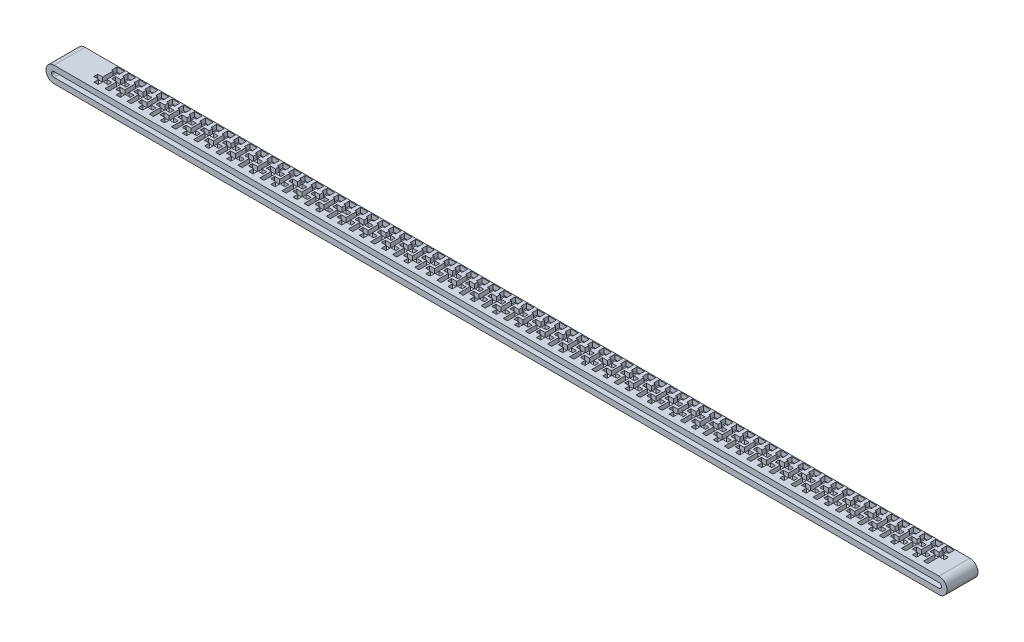
from build123d import *

# Parameters (mm, degrees)
BOSS_EXTRUDE1_DEPTH = 140
CUT_EXTRUDE1_DEPTH  = 21


with BuildPart() as part:
    # Sketch1 → Boss-Extrude1 (new body)
    with BuildSketch(Plane.XY):
        with BuildLine():
            Line((-3934.06198402, 39.535153864), (65.93801598, 39.535153864))
            ThreePointArc((65.93801598, 39.535153864), (102.323258292, 3.149911553), (65.93801598, -33.235330759))
            Line((65.93801598, -33.235330759), (-3934.06198402, -33.235330759))
            ThreePointArc((-3934.06198402, -33.235330759), (-3970.447226332, 3.149911553), (-3934.06198402, 39.535153864))
        make_face()
        with BuildLine():
            Line((-3934.06198402, 14.535153864), (65.93801598, 14.535153864))
            ThreePointArc((65.93801598, 14.535153864), (77.323258292, 3.149911553), (65.93801598, -8.235330759))
            Line((65.93801598, -8.235330759), (-3934.06198402, -8.235330759))
            ThreePointArc((-3934.06198402, -8.235330759), (-3945.447226332, 3.149911553), (-3934.06198402, 14.535153864))
        make_face(mode=Mode.SUBTRACT)
    extrude(amount=BOSS_EXTRUDE1_DEPTH)

    # Sketch2 → Cut-Extrude1 (cut)
    with BuildSketch(Plane(origin=(0, 39.535153864, 0), x_dir=(1, 0, 0), z_dir=(0, 1, 0))):
        Polygon((-3777.60668084, -116.120959158), (-3758.60668084, -116.120959158), (-3758.60668084, -93.616423016), (-3736.10668084, -93.616423016), (-3736.10668084, -76.5), (-3758.60668084, -76.5), (-3758.60668084, -29.120959158), (-3751.10668084, -29.120959158), (-3751.10668084, -4.120959158), (-3785.10668084, -4.120959158), (-3785.10668084, -29.120959158), (-3777.60668084, -29.120959158), (-3777.60668084, -76.5), (-3800.10668084, -76.5), (-3800.10668084, -94.5), (-3777.60668084, -94.5), align=None)
        Polygon((-3727.606672513, -116.120959158), (-3708.606672513, -116.120959158), (-3708.606672513, -63.5), (-3686.106672513, -63.5), (-3686.106672513, -45.5), (-3708.606672513, -45.5), (-3708.60668084, -29.120959158), (-3701.10668084, -29.120959158), (-3701.10668084, -4.120959158), (-3735.10668084, -4.120959158), (-3735.10668084, -29.120959158), (-3727.60668084, -29.120959158), (-3727.606672513, -45.5), (-3750.106672513, -45.5), (-3750.106672513, -63.5), (-3727.606672513, -63.5), align=None)
        Polygon((-3677.60668084, -94.5), (-3677.60668084, -116.120959158), (-3658.60668084, -116.120959158), (-3658.60668084, -93.616423016), (-3636.10668084, -93.616423016), (-3636.10668084, -76.5), (-3658.60668084, -76.5), (-3658.60668084, -29.120959158), (-3651.10668084, -29.120959158), (-3651.10668084, -4.120959158), (-3685.10668084, -4.120959158), (-3685.10668084, -29.120959158), (-3677.60668084, -29.120959158), (-3677.60668084, -76.5), (-3700.10668084, -76.5), (-3700.10668084, -94.5), align=None)
        Polygon((-3577.60668084, -94.5), (-3577.60668084, -116.120959158), (-3558.60668084, -116.120959158), (-3558.60668084, -93.616423016), (-3536.10668084, -93.616423016), (-3536.10668084, -76.5), (-3558.60668084, -76.5), (-3558.60668084, -29.120959158), (-3551.10668084, -29.120959158), (-3551.10668084, -4.120959158), (-3585.10668084, -4.120959158), (-3585.10668084, -29.120959158), (-3577.60668084, -29.120959158), (-3577.60668084, -76.5), (-3600.10668084, -76.5), (-3600.10668084, -94.5), align=None)
        Polygon((-3477.60668084, -94.5), (-3477.60668084, -116.120959158), (-3458.60668084, -116.120959158), (-3458.60668084, -93.616423016), (-3436.10668084, -93.616423016), (-3436.10668084, -76.5), (-3458.60668084, -76.5), (-3458.60668084, -29.120959158), (-3451.10668084, -29.120959158), (-3451.10668084, -4.120959158), (-3485.10668084, -4.120959158), (-3485.10668084, -29.120959158), (-3477.60668084, -29.120959158), (-3477.60668084, -76.5), (-3500.10668084, -76.5), (-3500.10668084, -94.5), align=None)
        Polygon((-3377.60668084, -94.5), (-3377.60668084, -116.120959158), (-3358.60668084, -116.120959158), (-3358.60668084, -93.616423016), (-3336.10668084, -93.616423016), (-3336.10668084, -76.5), (-3358.60668084, -76.5), (-3358.60668084, -29.120959158), (-3351.10668084, -29.120959158), (-3351.10668084, -4.120959158), (-3385.10668084, -4.120959158), (-3385.10668084, -29.120959158), (-3377.60668084, -29.120959158), (-3377.60668084, -76.5), (-3400.10668084, -76.5), (-3400.10668084, -94.5), align=None)
        Polygon((-3277.60668084, -94.5), (-3277.60668084, -116.120959158), (-3258.60668084, -116.120959158), (-3258.60668084, -93.616423016), (-3236.10668084, -93.616423016), (-3236.10668084, -76.5), (-3258.60668084, -76.5), (-3258.60668084, -29.120959158), (-3251.10668084, -29.120959158), (-3251.10668084, -4.120959158), (-3285.10668084, -4.120959158), (-3285.10668084, -29.120959158), (-3277.60668084, -29.120959158), (-3277.60668084, -76.5), (-3300.10668084, -76.5), (-3300.10668084, -94.5), align=None)
        Polygon((-3177.60668084, -94.5), (-3177.60668084, -116.120959158), (-3158.60668084, -116.120959158), (-3158.60668084, -93.616423016), (-3136.10668084, -93.616423016), (-3136.10668084, -76.5), (-3158.60668084, -76.5), (-3158.60668084, -29.120959158), (-3151.10668084, -29.120959158), (-3151.10668084, -4.120959158), (-3185.10668084, -4.120959158), (-3185.10668084, -29.120959158), (-3177.60668084, -29.120959158), (-3177.60668084, -76.5), (-3200.10668084, -76.5), (-3200.10668084, -94.5), align=None)
        Polygon((-3077.60668084, -94.5), (-3077.60668084, -116.120959158), (-3058.60668084, -116.120959158), (-3058.60668084, -93.616423016), (-3036.10668084, -93.616423016), (-3036.10668084, -76.5), (-3058.60668084, -76.5), (-3058.60668084, -29.120959158), (-3051.10668084, -29.120959158), (-3051.10668084, -4.120959158), (-3085.10668084, -4.120959158), (-3085.10668084, -29.120959158), (-3077.60668084, -29.120959158), (-3077.60668084, -76.5), (-3100.10668084, -76.5), (-3100.10668084, -94.5), align=None)
        Polygon((-2977.60668084, -94.5), (-2977.60668084, -116.120959158), (-2958.60668084, -116.120959158), (-2958.60668084, -93.616423016), (-2936.10668084, -93.616423016), (-2936.10668084, -76.5), (-2958.60668084, -76.5), (-2958.60668084, -29.120959158), (-2951.10668084, -29.120959158), (-2951.10668084, -4.120959158), (-2985.10668084, -4.120959158), (-2985.10668084, -29.120959158), (-2977.60668084, -29.120959158), (-2977.60668084, -76.5), (-3000.10668084, -76.5), (-3000.10668084, -94.5), align=None)
        Polygon((-2877.60668084, -94.5), (-2877.60668084, -116.120959158), (-2858.60668084, -116.120959158), (-2858.60668084, -93.616423016), (-2836.10668084, -93.616423016), (-2836.10668084, -76.5), (-2858.60668084, -76.5), (-2858.60668084, -29.120959158), (-2851.10668084, -29.120959158), (-2851.10668084, -4.120959158), (-2885.10668084, -4.120959158), (-2885.10668084, -29.120959158), (-2877.60668084, -29.120959158), (-2877.60668084, -76.5), (-2900.10668084, -76.5), (-2900.10668084, -94.5), align=None)
        Polygon((-2777.60668084, -94.5), (-2777.60668084, -116.120959158), (-2758.60668084, -116.120959158), (-2758.60668084, -93.616423016), (-2736.10668084, -93.616423016), (-2736.10668084, -76.5), (-2758.60668084, -76.5), (-2758.60668084, -29.120959158), (-2751.10668084, -29.120959158), (-2751.10668084, -4.120959158), (-2785.10668084, -4.120959158), (-2785.10668084, -29.120959158), (-2777.60668084, -29.120959158), (-2777.60668084, -76.5), (-2800.10668084, -76.5), (-2800.10668084, -94.5), align=None)
        Polygon((-2677.60668084, -94.5), (-2677.60668084, -116.120959158), (-2658.60668084, -116.120959158), (-2658.60668084, -93.616423016), (-2636.10668084, -93.616423016), (-2636.10668084, -76.5), (-2658.60668084, -76.5), (-2658.60668084, -29.120959158), (-2651.10668084, -29.120959158), (-2651.10668084, -4.120959158), (-2685.10668084, -4.120959158), (-2685.10668084, -29.120959158), (-2677.60668084, -29.120959158), (-2677.60668084, -76.5), (-2700.10668084, -76.5), (-2700.10668084, -94.5), align=None)
        Polygon((-2577.60668084, -94.5), (-2577.60668084, -116.120959158), (-2558.60668084, -116.120959158), (-2558.60668084, -93.616423016), (-2536.10668084, -93.616423016), (-2536.10668084, -76.5), (-2558.60668084, -76.5), (-2558.60668084, -29.120959158), (-2551.10668084, -29.120959158), (-2551.10668084, -4.120959158), (-2585.10668084, -4.120959158), (-2585.10668084, -29.120959158), (-2577.60668084, -29.120959158), (-2577.60668084, -76.5), (-2600.10668084, -76.5), (-2600.10668084, -94.5), align=None)
        Polygon((-2477.60668084, -94.5), (-2477.60668084, -116.120959158), (-2458.60668084, -116.120959158), (-2458.60668084, -93.616423016), (-2436.10668084, -93.616423016), (-2436.10668084, -76.5), (-2458.60668084, -76.5), (-2458.60668084, -29.120959158), (-2451.10668084, -29.120959158), (-2451.10668084, -4.120959158), (-2485.10668084, -4.120959158), (-2485.10668084, -29.120959158), (-2477.60668084, -29.120959158), (-2477.60668084, -76.5), (-2500.10668084, -76.5), (-2500.10668084, -94.5), align=None)
        Polygon((-2377.60668084, -94.5), (-2377.60668084, -116.120959158), (-2358.60668084, -116.120959158), (-2358.60668084, -93.616423016), (-2336.10668084, -93.616423016), (-2336.10668084, -76.5), (-2358.60668084, -76.5), (-2358.60668084, -29.120959158), (-2351.10668084, -29.120959158), (-2351.10668084, -4.120959158), (-2385.10668084, -4.120959158), (-2385.10668084, -29.120959158), (-2377.60668084, -29.120959158), (-2377.60668084, -76.5), (-2400.10668084, -76.5), (-2400.10668084, -94.5), align=None)
        Polygon((-2277.60668084, -94.5), (-2277.60668084, -116.120959158), (-2258.60668084, -116.120959158), (-2258.60668084, -93.616423016), (-2236.10668084, -93.616423016), (-2236.10668084, -76.5), (-2258.60668084, -76.5), (-2258.60668084, -29.120959158), (-2251.10668084, -29.120959158), (-2251.10668084, -4.120959158), (-2285.10668084, -4.120959158), (-2285.10668084, -29.120959158), (-2277.60668084, -29.120959158), (-2277.60668084, -76.5), (-2300.10668084, -76.5), (-2300.10668084, -94.5), align=None)
        Polygon((-2177.60668084, -94.5), (-2177.60668084, -116.120959158), (-2158.60668084, -116.120959158), (-2158.60668084, -93.616423016), (-2136.10668084, -93.616423016), (-2136.10668084, -76.5), (-2158.60668084, -76.5), (-2158.60668084, -29.120959158), (-2151.10668084, -29.120959158), (-2151.10668084, -4.120959158), (-2185.10668084, -4.120959158), (-2185.10668084, -29.120959158), (-2177.60668084, -29.120959158), (-2177.60668084, -76.5), (-2200.10668084, -76.5), (-2200.10668084, -94.5), align=None)
        Polygon((-2077.60668084, -94.5), (-2077.60668084, -116.120959158), (-2058.60668084, -116.120959158), (-2058.60668084, -93.616423016), (-2036.10668084, -93.616423016), (-2036.10668084, -76.5), (-2058.60668084, -76.5), (-2058.60668084, -29.120959158), (-2051.10668084, -29.120959158), (-2051.10668084, -4.120959158), (-2085.10668084, -4.120959158), (-2085.10668084, -29.120959158), (-2077.60668084, -29.120959158), (-2077.60668084, -76.5), (-2100.10668084, -76.5), (-2100.10668084, -94.5), align=None)
        Polygon((-1977.60668084, -94.5), (-1977.60668084, -116.120959158), (-1958.60668084, -116.120959158), (-1958.60668084, -93.616423016), (-1936.10668084, -93.616423016), (-1936.10668084, -76.5), (-1958.60668084, -76.5), (-1958.60668084, -29.120959158), (-1951.10668084, -29.120959158), (-1951.10668084, -4.120959158), (-1985.10668084, -4.120959158), (-1985.10668084, -29.120959158), (-1977.60668084, -29.120959158), (-1977.60668084, -76.5), (-2000.10668084, -76.5), (-2000.10668084, -94.5), align=None)
        Polygon((-1877.60668084, -94.5), (-1877.60668084, -116.120959158), (-1858.60668084, -116.120959158), (-1858.60668084, -93.616423016), (-1836.10668084, -93.616423016), (-1836.10668084, -76.5), (-1858.60668084, -76.5), (-1858.60668084, -29.120959158), (-1851.10668084, -29.120959158), (-1851.10668084, -4.120959158), (-1885.10668084, -4.120959158), (-1885.10668084, -29.120959158), (-1877.60668084, -29.120959158), (-1877.60668084, -76.5), (-1900.10668084, -76.5), (-1900.10668084, -94.5), align=None)
        Polygon((-1777.60668084, -94.5), (-1777.60668084, -116.120959158), (-1758.60668084, -116.120959158), (-1758.60668084, -93.616423016), (-1736.10668084, -93.616423016), (-1736.10668084, -76.5), (-1758.60668084, -76.5), (-1758.60668084, -29.120959158), (-1751.10668084, -29.120959158), (-1751.10668084, -4.120959158), (-1785.10668084, -4.120959158), (-1785.10668084, -29.120959158), (-1777.60668084, -29.120959158), (-1777.60668084, -76.5), (-1800.10668084, -76.5), (-1800.10668084, -94.5), align=None)
        Polygon((-1677.60668084, -94.5), (-1677.60668084, -116.120959158), (-1658.60668084, -116.120959158), (-1658.60668084, -93.616423016), (-1636.10668084, -93.616423016), (-1636.10668084, -76.5), (-1658.60668084, -76.5), (-1658.60668084, -29.120959158), (-1651.10668084, -29.120959158), (-1651.10668084, -4.120959158), (-1685.10668084, -4.120959158), (-1685.10668084, -29.120959158), (-1677.60668084, -29.120959158), (-1677.60668084, -76.5), (-1700.10668084, -76.5), (-1700.10668084, -94.5), align=None)
        Polygon((-1577.60668084, -94.5), (-1577.60668084, -116.120959158), (-1558.60668084, -116.120959158), (-1558.60668084, -93.616423016), (-1536.10668084, -93.616423016), (-1536.10668084, -76.5), (-1558.60668084, -76.5), (-1558.60668084, -29.120959158), (-1551.10668084, -29.120959158), (-1551.10668084, -4.120959158), (-1585.10668084, -4.120959158), (-1585.10668084, -29.120959158), (-1577.60668084, -29.120959158), (-1577.60668084, -76.5), (-1600.10668084, -76.5), (-1600.10668084, -94.5), align=None)
        Polygon((-1477.60668084, -94.5), (-1477.60668084, -116.120959158), (-1458.60668084, -116.120959158), (-1458.60668084, -93.616423016), (-1436.10668084, -93.616423016), (-1436.10668084, -76.5), (-1458.60668084, -76.5), (-1458.60668084, -29.120959158), (-1451.10668084, -29.120959158), (-1451.10668084, -4.120959158), (-1485.10668084, -4.120959158), (-1485.10668084, -29.120959158), (-1477.60668084, -29.120959158), (-1477.60668084, -76.5), (-1500.10668084, -76.5), (-1500.10668084, -94.5), align=None)
        Polygon((-1377.60668084, -94.5), (-1377.60668084, -116.120959158), (-1358.60668084, -116.120959158), (-1358.60668084, -93.616423016), (-1336.10668084, -93.616423016), (-1336.10668084, -76.5), (-1358.60668084, -76.5), (-1358.60668084, -29.120959158), (-1351.10668084, -29.120959158), (-1351.10668084, -4.120959158), (-1385.10668084, -4.120959158), (-1385.10668084, -29.120959158), (-1377.60668084, -29.120959158), (-1377.60668084, -76.5), (-1400.10668084, -76.5), (-1400.10668084, -94.5), align=None)
        Polygon((-1277.60668084, -94.5), (-1277.60668084, -116.120959158), (-1258.60668084, -116.120959158), (-1258.60668084, -93.616423016), (-1236.10668084, -93.616423016), (-1236.10668084, -76.5), (-1258.60668084, -76.5), (-1258.60668084, -29.120959158), (-1251.10668084, -29.120959158), (-1251.10668084, -4.120959158), (-1285.10668084, -4.120959158), (-1285.10668084, -29.120959158), (-1277.60668084, -29.120959158), (-1277.60668084, -76.5), (-1300.10668084, -76.5), (-1300.10668084, -94.5), align=None)
        Polygon((-1177.60668084, -94.5), (-1177.60668084, -116.120959158), (-1158.60668084, -116.120959158), (-1158.60668084, -93.616423016), (-1136.10668084, -93.616423016), (-1136.10668084, -76.5), (-1158.60668084, -76.5), (-1158.60668084, -29.120959158), (-1151.10668084, -29.120959158), (-1151.10668084, -4.120959158), (-1185.10668084, -4.120959158), (-1185.10668084, -29.120959158), (-1177.60668084, -29.120959158), (-1177.60668084, -76.5), (-1200.10668084, -76.5), (-1200.10668084, -94.5), align=None)
        Polygon((-1077.60668084, -94.5), (-1077.60668084, -116.120959158), (-1058.60668084, -116.120959158), (-1058.60668084, -93.616423016), (-1036.10668084, -93.616423016), (-1036.10668084, -76.5), (-1058.60668084, -76.5), (-1058.60668084, -29.120959158), (-1051.10668084, -29.120959158), (-1051.10668084, -4.120959158), (-1085.10668084, -4.120959158), (-1085.10668084, -29.120959158), (-1077.60668084, -29.120959158), (-1077.60668084, -76.5), (-1100.10668084, -76.5), (-1100.10668084, -94.5), align=None)
        Polygon((-977.60668084, -94.5), (-977.60668084, -116.120959158), (-958.60668084, -116.120959158), (-958.60668084, -93.616423016), (-936.10668084, -93.616423016), (-936.10668084, -76.5), (-958.60668084, -76.5), (-958.60668084, -29.120959158), (-951.10668084, -29.120959158), (-951.10668084, -4.120959158), (-985.10668084, -4.120959158), (-985.10668084, -29.120959158), (-977.60668084, -29.120959158), (-977.60668084, -76.5), (-1000.10668084, -76.5), (-1000.10668084, -94.5), align=None)
        Polygon((-877.60668084, -94.5), (-877.60668084, -116.120959158), (-858.60668084, -116.120959158), (-858.60668084, -93.616423016), (-836.10668084, -93.616423016), (-836.10668084, -76.5), (-858.60668084, -76.5), (-858.60668084, -29.120959158), (-851.10668084, -29.120959158), (-851.10668084, -4.120959158), (-885.10668084, -4.120959158), (-885.10668084, -29.120959158), (-877.60668084, -29.120959158), (-877.60668084, -76.5), (-900.10668084, -76.5), (-900.10668084, -94.5), align=None)
        Polygon((-777.60668084, -94.5), (-777.60668084, -116.120959158), (-758.60668084, -116.120959158), (-758.60668084, -93.616423016), (-736.10668084, -93.616423016), (-736.10668084, -76.5), (-758.60668084, -76.5), (-758.60668084, -29.120959158), (-751.10668084, -29.120959158), (-751.10668084, -4.120959158), (-785.10668084, -4.120959158), (-785.10668084, -29.120959158), (-777.60668084, -29.120959158), (-777.60668084, -76.5), (-800.10668084, -76.5), (-800.10668084, -94.5), align=None)
        Polygon((-677.60668084, -94.5), (-677.60668084, -116.120959158), (-658.60668084, -116.120959158), (-658.60668084, -93.616423016), (-636.10668084, -93.616423016), (-636.10668084, -76.5), (-658.60668084, -76.5), (-658.60668084, -29.120959158), (-651.10668084, -29.120959158), (-651.10668084, -4.120959158), (-685.10668084, -4.120959158), (-685.10668084, -29.120959158), (-677.60668084, -29.120959158), (-677.60668084, -76.5), (-700.10668084, -76.5), (-700.10668084, -94.5), align=None)
        Polygon((-577.60668084, -94.5), (-577.60668084, -116.120959158), (-558.60668084, -116.120959158), (-558.60668084, -93.616423016), (-536.10668084, -93.616423016), (-536.10668084, -76.5), (-558.60668084, -76.5), (-558.60668084, -29.120959158), (-551.10668084, -29.120959158), (-551.10668084, -4.120959158), (-585.10668084, -4.120959158), (-585.10668084, -29.120959158), (-577.60668084, -29.120959158), (-577.60668084, -76.5), (-600.10668084, -76.5), (-600.10668084, -94.5), align=None)
        Polygon((-477.60668084, -94.5), (-477.60668084, -116.120959158), (-458.60668084, -116.120959158), (-458.60668084, -93.616423016), (-436.10668084, -93.616423016), (-436.10668084, -76.5), (-458.60668084, -76.5), (-458.60668084, -29.120959158), (-451.10668084, -29.120959158), (-451.10668084, -4.120959158), (-485.10668084, -4.120959158), (-485.10668084, -29.120959158), (-477.60668084, -29.120959158), (-477.60668084, -76.5), (-500.10668084, -76.5), (-500.10668084, -94.5), align=None)
        Polygon((-377.60668084, -94.5), (-377.60668084, -116.120959158), (-358.60668084, -116.120959158), (-358.60668084, -93.616423016), (-336.10668084, -93.616423016), (-336.10668084, -76.5), (-358.60668084, -76.5), (-358.60668084, -29.120959158), (-351.10668084, -29.120959158), (-351.10668084, -4.120959158), (-385.10668084, -4.120959158), (-385.10668084, -29.120959158), (-377.60668084, -29.120959158), (-377.60668084, -76.5), (-400.10668084, -76.5), (-400.10668084, -94.5), align=None)
        Polygon((-277.60668084, -94.5), (-277.60668084, -116.120959158), (-258.60668084, -116.120959158), (-258.60668084, -93.616423016), (-236.10668084, -93.616423016), (-236.10668084, -76.5), (-258.60668084, -76.5), (-258.60668084, -29.120959158), (-251.10668084, -29.120959158), (-251.10668084, -4.120959158), (-285.10668084, -4.120959158), (-285.10668084, -29.120959158), (-277.60668084, -29.120959158), (-277.60668084, -76.5), (-300.10668084, -76.5), (-300.10668084, -94.5), align=None)
        Polygon((-177.60668084, -94.5), (-177.60668084, -116.120959158), (-158.60668084, -116.120959158), (-158.60668084, -93.616423016), (-136.10668084, -93.616423016), (-136.10668084, -76.5), (-158.60668084, -76.5), (-158.60668084, -29.120959158), (-151.10668084, -29.120959158), (-151.10668084, -4.120959158), (-185.10668084, -4.120959158), (-185.10668084, -29.120959158), (-177.60668084, -29.120959158), (-177.60668084, -76.5), (-200.10668084, -76.5), (-200.10668084, -94.5), align=None)
        Polygon((-77.60668084, -94.5), (-77.60668084, -116.120959158), (-58.60668084, -116.120959158), (-58.60668084, -93.616423016), (-36.10668084, -93.616423016), (-36.10668084, -76.5), (-58.60668084, -76.5), (-58.60668084, -29.120959158), (-51.10668084, -29.120959158), (-51.10668084, -4.120959158), (-85.10668084, -4.120959158), (-85.10668084, -29.120959158), (-77.60668084, -29.120959158), (-77.60668084, -76.5), (-100.10668084, -76.5), (-100.10668084, -94.5), align=None)
        Polygon((-3627.606672513, -63.5), (-3627.606672513, -116.120959158), (-3608.606672513, -116.120959158), (-3608.606672513, -63.5), (-3586.106672513, -63.5), (-3586.106672513, -45.5), (-3608.606672513, -45.5), (-3608.60668084, -29.120959158), (-3601.10668084, -29.120959158), (-3601.10668084, -4.120959158), (-3635.10668084, -4.120959158), (-3635.10668084, -29.120959158), (-3627.60668084, -29.120959158), (-3627.606672513, -45.5), (-3650.106672513, -45.5), (-3650.106672513, -63.5), align=None)
        Polygon((-3527.606672513, -63.5), (-3527.606672513, -116.120959158), (-3508.606672513, -116.120959158), (-3508.606672513, -63.5), (-3486.106672513, -63.5), (-3486.106672513, -45.5), (-3508.606672513, -45.5), (-3508.60668084, -29.120959158), (-3501.10668084, -29.120959158), (-3501.10668084, -4.120959158), (-3535.10668084, -4.120959158), (-3535.10668084, -29.120959158), (-3527.60668084, -29.120959158), (-3527.606672513, -45.5), (-3550.106672513, -45.5), (-3550.106672513, -63.5), align=None)
        Polygon((-3427.606672513, -63.5), (-3427.606672513, -116.120959158), (-3408.606672513, -116.120959158), (-3408.606672513, -63.5), (-3386.106672513, -63.5), (-3386.106672513, -45.5), (-3408.606672513, -45.5), (-3408.60668084, -29.120959158), (-3401.10668084, -29.120959158), (-3401.10668084, -4.120959158), (-3435.10668084, -4.120959158), (-3435.10668084, -29.120959158), (-3427.60668084, -29.120959158), (-3427.606672513, -45.5), (-3450.106672513, -45.5), (-3450.106672513, -63.5), align=None)
        Polygon((-3327.606672513, -63.5), (-3327.606672513, -116.120959158), (-3308.606672513, -116.120959158), (-3308.606672513, -63.5), (-3286.106672513, -63.5), (-3286.106672513, -45.5), (-3308.606672513, -45.5), (-3308.60668084, -29.120959158), (-3301.10668084, -29.120959158), (-3301.10668084, -4.120959158), (-3335.10668084, -4.120959158), (-3335.10668084, -29.120959158), (-3327.60668084, -29.120959158), (-3327.606672513, -45.5), (-3350.106672513, -45.5), (-3350.106672513, -63.5), align=None)
        Polygon((-3227.606672513, -63.5), (-3227.606672513, -116.120959158), (-3208.606672513, -116.120959158), (-3208.606672513, -63.5), (-3186.106672513, -63.5), (-3186.106672513, -45.5), (-3208.606672513, -45.5), (-3208.60668084, -29.120959158), (-3201.10668084, -29.120959158), (-3201.10668084, -4.120959158), (-3235.10668084, -4.120959158), (-3235.10668084, -29.120959158), (-3227.60668084, -29.120959158), (-3227.606672513, -45.5), (-3250.106672513, -45.5), (-3250.106672513, -63.5), align=None)
        Polygon((-3127.606672513, -63.5), (-3127.606672513, -116.120959158), (-3108.606672513, -116.120959158), (-3108.606672513, -63.5), (-3086.106672513, -63.5), (-3086.106672513, -45.5), (-3108.606672513, -45.5), (-3108.60668084, -29.120959158), (-3101.10668084, -29.120959158), (-3101.10668084, -4.120959158), (-3135.10668084, -4.120959158), (-3135.10668084, -29.120959158), (-3127.60668084, -29.120959158), (-3127.606672513, -45.5), (-3150.106672513, -45.5), (-3150.106672513, -63.5), align=None)
        Polygon((-3027.606672513, -63.5), (-3027.606672513, -116.120959158), (-3008.606672513, -116.120959158), (-3008.606672513, -63.5), (-2986.106672513, -63.5), (-2986.106672513, -45.5), (-3008.606672513, -45.5), (-3008.60668084, -29.120959158), (-3001.10668084, -29.120959158), (-3001.10668084, -4.120959158), (-3035.10668084, -4.120959158), (-3035.10668084, -29.120959158), (-3027.60668084, -29.120959158), (-3027.606672513, -45.5), (-3050.106672513, -45.5), (-3050.106672513, -63.5), align=None)
        Polygon((-2927.606672513, -63.5), (-2927.606672513, -116.120959158), (-2908.606672513, -116.120959158), (-2908.606672513, -63.5), (-2886.106672513, -63.5), (-2886.106672513, -45.5), (-2908.606672513, -45.5), (-2908.60668084, -29.120959158), (-2901.10668084, -29.120959158), (-2901.10668084, -4.120959158), (-2935.10668084, -4.120959158), (-2935.10668084, -29.120959158), (-2927.60668084, -29.120959158), (-2927.606672513, -45.5), (-2950.106672513, -45.5), (-2950.106672513, -63.5), align=None)
        Polygon((-2827.606672513, -63.5), (-2827.606672513, -116.120959158), (-2808.606672513, -116.120959158), (-2808.606672513, -63.5), (-2786.106672513, -63.5), (-2786.106672513, -45.5), (-2808.606672513, -45.5), (-2808.60668084, -29.120959158), (-2801.10668084, -29.120959158), (-2801.10668084, -4.120959158), (-2835.10668084, -4.120959158), (-2835.10668084, -29.120959158), (-2827.60668084, -29.120959158), (-2827.606672513, -45.5), (-2850.106672513, -45.5), (-2850.106672513, -63.5), align=None)
        Polygon((-2727.606672513, -63.5), (-2727.606672513, -116.120959158), (-2708.606672513, -116.120959158), (-2708.606672513, -63.5), (-2686.106672513, -63.5), (-2686.106672513, -45.5), (-2708.606672513, -45.5), (-2708.60668084, -29.120959158), (-2701.10668084, -29.120959158), (-2701.10668084, -4.120959158), (-2735.10668084, -4.120959158), (-2735.10668084, -29.120959158), (-2727.60668084, -29.120959158), (-2727.606672513, -45.5), (-2750.106672513, -45.5), (-2750.106672513, -63.5), align=None)
        Polygon((-2627.606672513, -63.5), (-2627.606672513, -116.120959158), (-2608.606672513, -116.120959158), (-2608.606672513, -63.5), (-2586.106672513, -63.5), (-2586.106672513, -45.5), (-2608.606672513, -45.5), (-2608.60668084, -29.120959158), (-2601.10668084, -29.120959158), (-2601.10668084, -4.120959158), (-2635.10668084, -4.120959158), (-2635.10668084, -29.120959158), (-2627.60668084, -29.120959158), (-2627.606672513, -45.5), (-2650.106672513, -45.5), (-2650.106672513, -63.5), align=None)
        Polygon((-2527.606672513, -63.5), (-2527.606672513, -116.120959158), (-2508.606672513, -116.120959158), (-2508.606672513, -63.5), (-2486.106672513, -63.5), (-2486.106672513, -45.5), (-2508.606672513, -45.5), (-2508.60668084, -29.120959158), (-2501.10668084, -29.120959158), (-2501.10668084, -4.120959158), (-2535.10668084, -4.120959158), (-2535.10668084, -29.120959158), (-2527.60668084, -29.120959158), (-2527.606672513, -45.5), (-2550.106672513, -45.5), (-2550.106672513, -63.5), align=None)
        Polygon((-2427.606672513, -63.5), (-2427.606672513, -116.120959158), (-2408.606672513, -116.120959158), (-2408.606672513, -63.5), (-2386.106672513, -63.5), (-2386.106672513, -45.5), (-2408.606672513, -45.5), (-2408.60668084, -29.120959158), (-2401.10668084, -29.120959158), (-2401.10668084, -4.120959158), (-2435.10668084, -4.120959158), (-2435.10668084, -29.120959158), (-2427.60668084, -29.120959158), (-2427.606672513, -45.5), (-2450.106672513, -45.5), (-2450.106672513, -63.5), align=None)
        Polygon((-2327.606672513, -63.5), (-2327.606672513, -116.120959158), (-2308.606672513, -116.120959158), (-2308.606672513, -63.5), (-2286.106672513, -63.5), (-2286.106672513, -45.5), (-2308.606672513, -45.5), (-2308.60668084, -29.120959158), (-2301.10668084, -29.120959158), (-2301.10668084, -4.120959158), (-2335.10668084, -4.120959158), (-2335.10668084, -29.120959158), (-2327.60668084, -29.120959158), (-2327.606672513, -45.5), (-2350.106672513, -45.5), (-2350.106672513, -63.5), align=None)
        Polygon((-2227.606672513, -63.5), (-2227.606672513, -116.120959158), (-2208.606672513, -116.120959158), (-2208.606672513, -63.5), (-2186.106672513, -63.5), (-2186.106672513, -45.5), (-2208.606672513, -45.5), (-2208.60668084, -29.120959158), (-2201.10668084, -29.120959158), (-2201.10668084, -4.120959158), (-2235.10668084, -4.120959158), (-2235.10668084, -29.120959158), (-2227.60668084, -29.120959158), (-2227.606672513, -45.5), (-2250.106672513, -45.5), (-2250.106672513, -63.5), align=None)
        Polygon((-2127.606672513, -63.5), (-2127.606672513, -116.120959158), (-2108.606672513, -116.120959158), (-2108.606672513, -63.5), (-2086.106672513, -63.5), (-2086.106672513, -45.5), (-2108.606672513, -45.5), (-2108.60668084, -29.120959158), (-2101.10668084, -29.120959158), (-2101.10668084, -4.120959158), (-2135.10668084, -4.120959158), (-2135.10668084, -29.120959158), (-2127.60668084, -29.120959158), (-2127.606672513, -45.5), (-2150.106672513, -45.5), (-2150.106672513, -63.5), align=None)
        Polygon((-2027.606672513, -63.5), (-2027.606672513, -116.120959158), (-2008.606672513, -116.120959158), (-2008.606672513, -63.5), (-1986.106672513, -63.5), (-1986.106672513, -45.5), (-2008.606672513, -45.5), (-2008.60668084, -29.120959158), (-2001.10668084, -29.120959158), (-2001.10668084, -4.120959158), (-2035.10668084, -4.120959158), (-2035.10668084, -29.120959158), (-2027.60668084, -29.120959158), (-2027.606672513, -45.5), (-2050.106672513, -45.5), (-2050.106672513, -63.5), align=None)
        Polygon((-1927.606672513, -63.5), (-1927.606672513, -116.120959158), (-1908.606672513, -116.120959158), (-1908.606672513, -63.5), (-1886.106672513, -63.5), (-1886.106672513, -45.5), (-1908.606672513, -45.5), (-1908.60668084, -29.120959158), (-1901.10668084, -29.120959158), (-1901.10668084, -4.120959158), (-1935.10668084, -4.120959158), (-1935.10668084, -29.120959158), (-1927.60668084, -29.120959158), (-1927.606672513, -45.5), (-1950.106672513, -45.5), (-1950.106672513, -63.5), align=None)
        Polygon((-1827.606672513, -63.5), (-1827.606672513, -116.120959158), (-1808.606672513, -116.120959158), (-1808.606672513, -63.5), (-1786.106672513, -63.5), (-1786.106672513, -45.5), (-1808.606672513, -45.5), (-1808.60668084, -29.120959158), (-1801.10668084, -29.120959158), (-1801.10668084, -4.120959158), (-1835.10668084, -4.120959158), (-1835.10668084, -29.120959158), (-1827.60668084, -29.120959158), (-1827.606672513, -45.5), (-1850.106672513, -45.5), (-1850.106672513, -63.5), align=None)
        Polygon((-1727.606672513, -63.5), (-1727.606672513, -116.120959158), (-1708.606672513, -116.120959158), (-1708.606672513, -63.5), (-1686.106672513, -63.5), (-1686.106672513, -45.5), (-1708.606672513, -45.5), (-1708.60668084, -29.120959158), (-1701.10668084, -29.120959158), (-1701.10668084, -4.120959158), (-1735.10668084, -4.120959158), (-1735.10668084, -29.120959158), (-1727.60668084, -29.120959158), (-1727.606672513, -45.5), (-1750.106672513, -45.5), (-1750.106672513, -63.5), align=None)
        Polygon((-1627.606672513, -63.5), (-1627.606672513, -116.120959158), (-1608.606672513, -116.120959158), (-1608.606672513, -63.5), (-1586.106672513, -63.5), (-1586.106672513, -45.5), (-1608.606672513, -45.5), (-1608.60668084, -29.120959158), (-1601.10668084, -29.120959158), (-1601.10668084, -4.120959158), (-1635.10668084, -4.120959158), (-1635.10668084, -29.120959158), (-1627.60668084, -29.120959158), (-1627.606672513, -45.5), (-1650.106672513, -45.5), (-1650.106672513, -63.5), align=None)
        Polygon((-1527.606672513, -63.5), (-1527.606672513, -116.120959158), (-1508.606672513, -116.120959158), (-1508.606672513, -63.5), (-1486.106672513, -63.5), (-1486.106672513, -45.5), (-1508.606672513, -45.5), (-1508.60668084, -29.120959158), (-1501.10668084, -29.120959158), (-1501.10668084, -4.120959158), (-1535.10668084, -4.120959158), (-1535.10668084, -29.120959158), (-1527.60668084, -29.120959158), (-1527.606672513, -45.5), (-1550.106672513, -45.5), (-1550.106672513, -63.5), align=None)
        Polygon((-1427.606672513, -63.5), (-1427.606672513, -116.120959158), (-1408.606672513, -116.120959158), (-1408.606672513, -63.5), (-1386.106672513, -63.5), (-1386.106672513, -45.5), (-1408.606672513, -45.5), (-1408.60668084, -29.120959158), (-1401.10668084, -29.120959158), (-1401.10668084, -4.120959158), (-1435.10668084, -4.120959158), (-1435.10668084, -29.120959158), (-1427.60668084, -29.120959158), (-1427.606672513, -45.5), (-1450.106672513, -45.5), (-1450.106672513, -63.5), align=None)
        Polygon((-1327.606672513, -63.5), (-1327.606672513, -116.120959158), (-1308.606672513, -116.120959158), (-1308.606672513, -63.5), (-1286.106672513, -63.5), (-1286.106672513, -45.5), (-1308.606672513, -45.5), (-1308.60668084, -29.120959158), (-1301.10668084, -29.120959158), (-1301.10668084, -4.120959158), (-1335.10668084, -4.120959158), (-1335.10668084, -29.120959158), (-1327.60668084, -29.120959158), (-1327.606672513, -45.5), (-1350.106672513, -45.5), (-1350.106672513, -63.5), align=None)
        Polygon((-1227.606672513, -63.5), (-1227.606672513, -116.120959158), (-1208.606672513, -116.120959158), (-1208.606672513, -63.5), (-1186.106672513, -63.5), (-1186.106672513, -45.5), (-1208.606672513, -45.5), (-1208.60668084, -29.120959158), (-1201.10668084, -29.120959158), (-1201.10668084, -4.120959158), (-1235.10668084, -4.120959158), (-1235.10668084, -29.120959158), (-1227.60668084, -29.120959158), (-1227.606672513, -45.5), (-1250.106672513, -45.5), (-1250.106672513, -63.5), align=None)
        Polygon((-1127.606672513, -63.5), (-1127.606672513, -116.120959158), (-1108.606672513, -116.120959158), (-1108.606672513, -63.5), (-1086.106672513, -63.5), (-1086.106672513, -45.5), (-1108.606672513, -45.5), (-1108.60668084, -29.120959158), (-1101.10668084, -29.120959158), (-1101.10668084, -4.120959158), (-1135.10668084, -4.120959158), (-1135.10668084, -29.120959158), (-1127.60668084, -29.120959158), (-1127.606672513, -45.5), (-1150.106672513, -45.5), (-1150.106672513, -63.5), align=None)
        Polygon((-1027.606672513, -63.5), (-1027.606672513, -116.120959158), (-1008.606672513, -116.120959158), (-1008.606672513, -63.5), (-986.106672513, -63.5), (-986.106672513, -45.5), (-1008.606672513, -45.5), (-1008.60668084, -29.120959158), (-1001.10668084, -29.120959158), (-1001.10668084, -4.120959158), (-1035.10668084, -4.120959158), (-1035.10668084, -29.120959158), (-1027.60668084, -29.120959158), (-1027.606672513, -45.5), (-1050.106672513, -45.5), (-1050.106672513, -63.5), align=None)
        Polygon((-927.606672513, -63.5), (-927.606672513, -116.120959158), (-908.606672513, -116.120959158), (-908.606672513, -63.5), (-886.106672513, -63.5), (-886.106672513, -45.5), (-908.606672513, -45.5), (-908.60668084, -29.120959158), (-901.10668084, -29.120959158), (-901.10668084, -4.120959158), (-935.10668084, -4.120959158), (-935.10668084, -29.120959158), (-927.60668084, -29.120959158), (-927.606672513, -45.5), (-950.106672513, -45.5), (-950.106672513, -63.5), align=None)
        Polygon((-827.606672513, -63.5), (-827.606672513, -116.120959158), (-808.606672513, -116.120959158), (-808.606672513, -63.5), (-786.106672513, -63.5), (-786.106672513, -45.5), (-808.606672513, -45.5), (-808.60668084, -29.120959158), (-801.10668084, -29.120959158), (-801.10668084, -4.120959158), (-835.10668084, -4.120959158), (-835.10668084, -29.120959158), (-827.60668084, -29.120959158), (-827.606672513, -45.5), (-850.106672513, -45.5), (-850.106672513, -63.5), align=None)
        Polygon((-727.606672513, -63.5), (-727.606672513, -116.120959158), (-708.606672513, -116.120959158), (-708.606672513, -63.5), (-686.106672513, -63.5), (-686.106672513, -45.5), (-708.606672513, -45.5), (-708.60668084, -29.120959158), (-701.10668084, -29.120959158), (-701.10668084, -4.120959158), (-735.10668084, -4.120959158), (-735.10668084, -29.120959158), (-727.60668084, -29.120959158), (-727.606672513, -45.5), (-750.106672513, -45.5), (-750.106672513, -63.5), align=None)
        Polygon((-627.606672513, -63.5), (-627.606672513, -116.120959158), (-608.606672513, -116.120959158), (-608.606672513, -63.5), (-586.106672513, -63.5), (-586.106672513, -45.5), (-608.606672513, -45.5), (-608.60668084, -29.120959158), (-601.10668084, -29.120959158), (-601.10668084, -4.120959158), (-635.10668084, -4.120959158), (-635.10668084, -29.120959158), (-627.60668084, -29.120959158), (-627.606672513, -45.5), (-650.106672513, -45.5), (-650.106672513, -63.5), align=None)
        Polygon((-527.606672513, -63.5), (-527.606672513, -116.120959158), (-508.606672513, -116.120959158), (-508.606672513, -63.5), (-486.106672513, -63.5), (-486.106672513, -45.5), (-508.606672513, -45.5), (-508.60668084, -29.120959158), (-501.10668084, -29.120959158), (-501.10668084, -4.120959158), (-535.10668084, -4.120959158), (-535.10668084, -29.120959158), (-527.60668084, -29.120959158), (-527.606672513, -45.5), (-550.106672513, -45.5), (-550.106672513, -63.5), align=None)
        Polygon((-427.606672513, -63.5), (-427.606672513, -116.120959158), (-408.606672513, -116.120959158), (-408.606672513, -63.5), (-386.106672513, -63.5), (-386.106672513, -45.5), (-408.606672513, -45.5), (-408.60668084, -29.120959158), (-401.10668084, -29.120959158), (-401.10668084, -4.120959158), (-435.10668084, -4.120959158), (-435.10668084, -29.120959158), (-427.60668084, -29.120959158), (-427.606672513, -45.5), (-450.106672513, -45.5), (-450.106672513, -63.5), align=None)
        Polygon((-327.606672513, -63.5), (-327.606672513, -116.120959158), (-308.606672513, -116.120959158), (-308.606672513, -63.5), (-286.106672513, -63.5), (-286.106672513, -45.5), (-308.606672513, -45.5), (-308.60668084, -29.120959158), (-301.10668084, -29.120959158), (-301.10668084, -4.120959158), (-335.10668084, -4.120959158), (-335.10668084, -29.120959158), (-327.60668084, -29.120959158), (-327.606672513, -45.5), (-350.106672513, -45.5), (-350.106672513, -63.5), align=None)
        Polygon((-227.606672513, -63.5), (-227.606672513, -116.120959158), (-208.606672513, -116.120959158), (-208.606672513, -63.5), (-186.106672513, -63.5), (-186.106672513, -45.5), (-208.606672513, -45.5), (-208.60668084, -29.120959158), (-201.10668084, -29.120959158), (-201.10668084, -4.120959158), (-235.10668084, -4.120959158), (-235.10668084, -29.120959158), (-227.60668084, -29.120959158), (-227.606672513, -45.5), (-250.106672513, -45.5), (-250.106672513, -63.5), align=None)
        Polygon((-127.606672513, -63.5), (-127.606672513, -116.120959158), (-108.606672513, -116.120959158), (-108.606672513, -63.5), (-86.106672513, -63.5), (-86.106672513, -45.5), (-108.606672513, -45.5), (-108.60668084, -29.120959158), (-101.10668084, -29.120959158), (-101.10668084, -4.120959158), (-135.10668084, -4.120959158), (-135.10668084, -29.120959158), (-127.60668084, -29.120959158), (-127.606672513, -45.5), (-150.106672513, -45.5), (-150.106672513, -63.5), align=None)
        Polygon((-27.606672513, -63.5), (-27.606672513, -116.120959158), (-8.606672513, -116.120959158), (-8.606672513, -63.5), (13.893327487, -63.5), (13.893327487, -45.5), (-8.606672513, -45.5), (-8.60668084, -29.120959158), (-1.10668084, -29.120959158), (-1.10668084, -4.120959158), (-35.10668084, -4.120959158), (-35.10668084, -29.120959158), (-27.60668084, -29.120959158), (-27.606672513, -45.5), (-50.106672513, -45.5), (-50.106672513, -63.5), align=None)
    extrude(amount=-CUT_EXTRUDE1_DEPTH, mode=Mode.SUBTRACT)


solid = part.part
